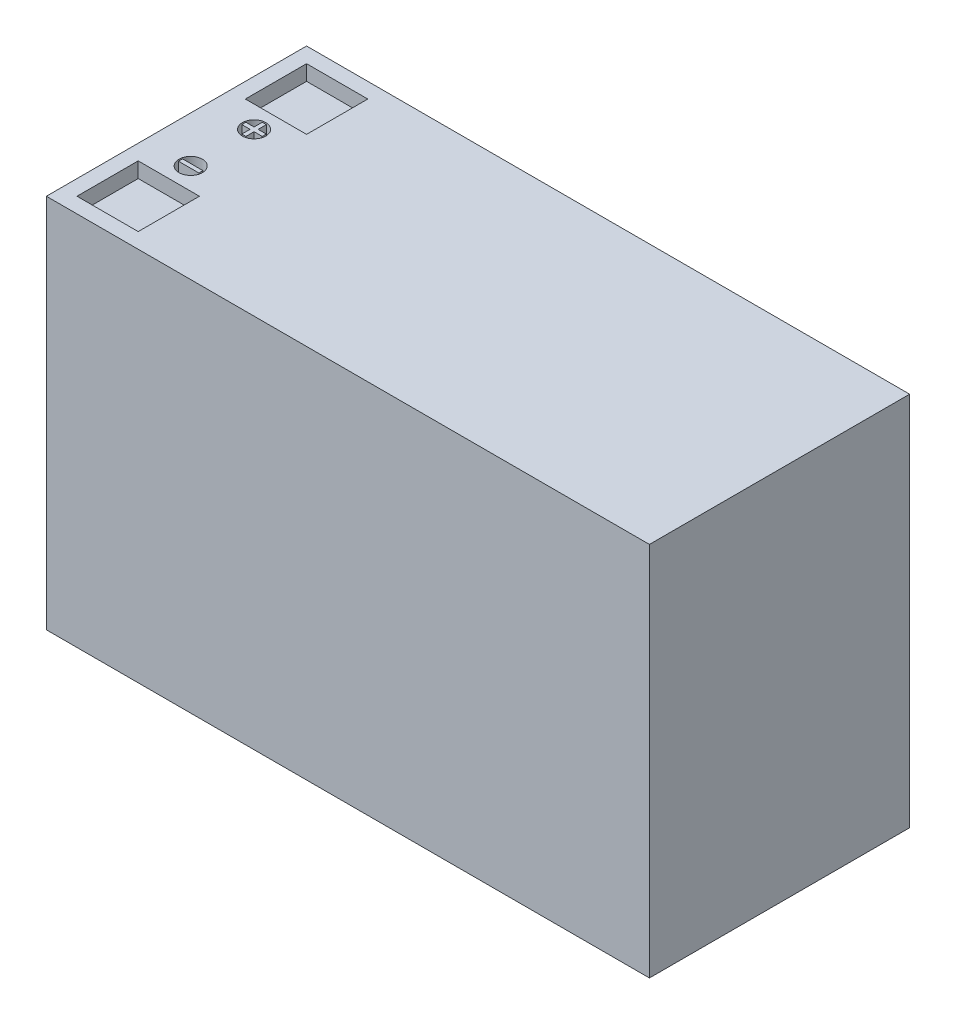
from build123d import *

# Parameters (mm, degrees)
SKETCH1_W           = 150.114
SKETCH1_H           = 64.77
BOSS_EXTRUDE1_DEPTH = 93.472
SKETCH2_W           = 15.24
SKETCH2_H           = 15.24
SKETCH2_R           = 2.91386686
SKETCH2_W_2         = 5.08
SKETCH2_H_2         = 1.016
CUT_EXTRUDE1_DEPTH  = 3.81


with BuildPart() as part:
    # Sketch1 → Boss-Extrude1 (new body)
    with BuildSketch(Plane(origin=(0, 0, 0), x_dir=(1, 0, 0), z_dir=(0, 1, 0))):
        with Locations((3.604380952, 5.860142857)):
            Rectangle(SKETCH1_W, SKETCH1_H)
    extrude(amount=BOSS_EXTRUDE1_DEPTH)

    # Sketch2 → Cut-Extrude1 (cut)
    # profile 1 of 4: a face of its own
    with BuildSketch(Plane(origin=(0, 93.472, 0), x_dir=(1, 0, 0), z_dir=(0, 1, 0))):
        with Locations((-60.022619048, -15.094857143)):
            Rectangle(SKETCH2_W, SKETCH2_H)
    # profile 2 of 4: a face of its own
    with BuildSketch(Plane(origin=(0, 93.472, 0), x_dir=(1, 0, 0), z_dir=(0, 1, 0))):
        with Locations((-60.022619048, 26.815142857)):
            Rectangle(SKETCH2_W, SKETCH2_H)
    # profile 3 of 4: a face of its own
    with BuildSketch(Plane(origin=(0, 93.472, 0), x_dir=(1, 0, 0), z_dir=(0, 1, 0))):
        with Locations((-60.022619048, -2.026557143)):
            Circle(SKETCH2_R)
        with Locations((-60.022619048, -2.026557143)):
            Rectangle(SKETCH2_W_2, SKETCH2_H_2, mode=Mode.SUBTRACT)
    # profile 4 of 4: a face of its own
    with BuildSketch(Plane(origin=(0, 93.472, 0), x_dir=(1, 0, 0), z_dir=(0, 1, 0))):
        with Locations((-60.022619048, 13.746842857)):
            Circle(SKETCH2_R)
        Polygon((-57.482619048, 14.254842857), (-57.482619048, 13.238842857), (-59.515974161, 13.238842857), (-59.515974161, 11.206842857), (-60.531974161, 11.206842857), (-60.531974161, 13.238842857), (-62.562619048, 13.238842857), (-62.562619048, 14.254842857), (-60.531974161, 14.254842857), (-60.531974161, 16.286842857), (-59.515974161, 16.286842857), (-59.515974161, 14.254842857), align=None, mode=Mode.SUBTRACT)
    extrude(amount=-CUT_EXTRUDE1_DEPTH, mode=Mode.SUBTRACT)


solid = part.part
